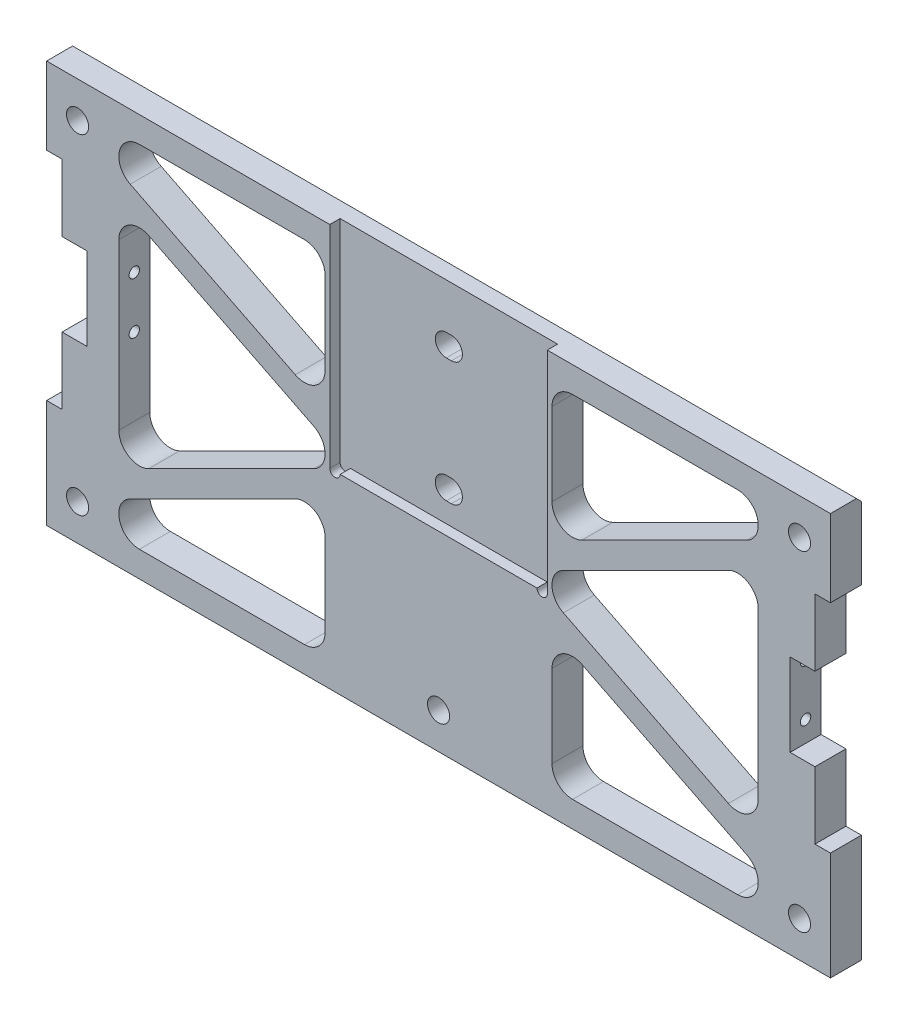
from build123d import *

# Parameters (mm, degrees)
SKETCH1_W                 = 120.65
SKETCH1_H                 = 61.9125
BOSS_EXTRUDE1_DEPTH       = 4.7625
SKETCH2_W                 = 4.7625
SKETCH2_H                 = 12.7254
BOSS_EXTRUDE2_DEPTH       = 22.225
CUT_EXTRUDE1_REACH        = 129.448
SKETCH3_R                 = 2.25
FILLET1_R                 = 6.35
FILLET1_OF_MIRROR2_R      = 6.35
M3_CLEARANCE_SLOT1_DEPTH  = 4.7625
SKETCH7_W                 = 2.38125
SKETCH7_H                 = 10.31875
CUT_EXTRUDE3_DEPTH        = 72.353666087
CUT_EXTRUDE4_DEPTH        = 6.207125
CUT_EXTRUDE5_DEPTH        = 72.353666087
CUT_EXTRUDE6_DEPTH        = 72.353666087
M2X0_4_TAPPED_HOLE1_D     = 1.6
M2X0_4_TAPPED_HOLE1_DEPTH = 4.905375
CUT_EXTRUDE7_DEPTH        = 1.5875
M3_CLEARANCE_HOLE2_D      = 3.4
CHAMFER1_SIZE             = 0.762


# Read off the part's stored shape, not the designer's step: M3 Clearance Slot1
with BuildPart() as part:
    # Sketch1 → Boss-Extrude1 (new body)
    with BuildSketch(Plane.XY):
        Rectangle(SKETCH1_W, SKETCH1_H)
    extrude(amount=BOSS_EXTRUDE1_DEPTH)

    # Sketch2 → Boss-Extrude2 (add)
    with BuildSketch(Plane.XY.offset(4.7625)):
        with Locations((-57.94375, 2.38125)):
            Rectangle(SKETCH2_W, SKETCH2_H)
    boss_extrude2 = extrude(amount=BOSS_EXTRUDE2_DEPTH)

    # Sketch3 → Cut-Extrude1 (cut, up to next)
    with BuildSketch(Plane.ZY.offset(60.325), mode=Mode.PRIVATE) as cut_extrude1_sk1:
        with Locations((19.05, 2.36855)):
            Circle(SKETCH3_R)
    cut_extrude1_tool1 = extrude(cut_extrude1_sk1.sketch, amount=-CUT_EXTRUDE1_REACH, mode=Mode.PRIVATE) & part.part
    cut_extrude1 = cut_extrude1_tool1.solids().sort_by_distance((-60.325, 2.36855, 19.05))[0]
    add(cut_extrude1, mode=Mode.SUBTRACT)

    # Fillet1
    fillet1_edges = [part.edges().sort_by_distance(p)[0] for p in [
        (-57.94375, -3.98145, 26.9875),
        (-57.94375, 8.74395, 26.9875),
    ]]
    fillet(fillet1_edges, radius=FILLET1_R)

    # Mirror2: Boss-Extrude2, Cut-Extrude1 across plane
    add(boss_extrude2.mirror(Plane(origin=(0, 0, 0), x_dir=(0, 0, 1), z_dir=(1, 0, 0))))
    add(cut_extrude1.mirror(Plane(origin=(0, 0, 0), x_dir=(0, 0, 1), z_dir=(1, 0, 0))), mode=Mode.SUBTRACT)

    # Fillet1 of Mirror2
    fillet1_of_mirror2_edges = [part.edges().sort_by_distance(p)[0] for p in [
        (57.94375, -3.98145, 26.9875),
        (57.94375, 8.74395, 26.9875),
    ]]
    fillet(fillet1_of_mirror2_edges, radius=FILLET1_OF_MIRROR2_R)

    # M3 Clearance Slot1 outline → M3 Clearance Slot1 (cut)
    with BuildSketch(Plane.XY):
        with BuildLine():
            ThreePointArc((0.386099968, 1.50675), (2.086099968, 3.20675), (0.386099968, 4.90675))
            Line((0.386099968, 4.90675), (-0.386099968, 4.90675))
            ThreePointArc((-0.386099968, 4.90675), (-2.086099968, 3.20675), (-0.386099968, 1.50675))
            Line((-0.386099968, 1.50675), (0.386099968, 1.50675))
        make_face()
        with BuildLine():
            ThreePointArc((0.386099968, 20.55675), (2.086099968, 22.25675), (0.386099968, 23.95675))
            Line((0.386099968, 23.95675), (-0.386099968, 23.95675))
            ThreePointArc((-0.386099968, 23.95675), (-2.086099968, 22.25675), (-0.386099968, 20.55675))
            Line((-0.386099968, 20.55675), (0.386099968, 20.55675))
        make_face()
    extrude(amount=M3_CLEARANCE_SLOT1_DEPTH, mode=Mode.SUBTRACT)

    # Sketch7 → Cut-Extrude3 (cut, through all)
    with BuildSketch(Plane.XY.offset(4.7625)):
        with Locations((-59.134375, 13.903325)):
            Rectangle(SKETCH7_W, SKETCH7_H)
        with Locations((-59.134375, -9.140825)):
            Rectangle(SKETCH7_W, SKETCH7_H)
    cut_extrude3 = extrude(amount=-CUT_EXTRUDE3_DEPTH, mode=Mode.SUBTRACT)

    # Sketch8 → Cut-Extrude4 (cut)
    with BuildSketch(Plane.ZY.offset(60.325)):
        with BuildLine():
            Line((0, 8.74395), (0, -3.98145))
            Line((0, -3.98145), (20.6375, -3.98145))
            ThreePointArc((20.6375, -3.98145), (25.127628061, -2.121578061), (26.9875, 2.36855))
            Line((26.9875, 2.36855), (26.9875, 2.39395))
            ThreePointArc((26.9875, 2.39395), (25.127628061, 6.884078061), (20.6375, 8.74395))
            Line((20.6375, 8.74395), (0, 8.74395))
        make_face()
    cut_extrude4 = extrude(amount=-CUT_EXTRUDE4_DEPTH, mode=Mode.SUBTRACT)

    # Sketch11 → Cut-Extrude5 (cut, through all)
    with BuildSketch(Plane.XY.offset(4.7625)):
        with BuildLine():
            Line((-19.217596834, 2.839806331), (-44.617596834, 15.539806331))
            ThreePointArc((-44.617596834, 15.539806331), (-47.706696281, 15.400816317), (-49.2125, 12.7))
            Line((-49.2125, 12.7), (-49.2125, -12.7))
            ThreePointArc((-49.2125, -12.7), (-47.706696281, -15.400816317), (-44.617596834, -15.539806331))
            Line((-44.617596834, -15.539806331), (-19.217596834, -2.839806331))
            ThreePointArc((-19.217596834, -2.839806331), (-17.4625, 0), (-19.217596834, 2.839806331))
        make_face()
    cut_extrude5 = extrude(amount=-CUT_EXTRUDE5_DEPTH, mode=Mode.SUBTRACT)

    # Sketch12 → Cut-Extrude6 (cut, through all)
    with BuildSketch(Plane.XY.offset(4.7625)):
        with BuildLine():
            Line((-47.457403166, 20.972693669), (-22.057403166, 8.272693669))
            ThreePointArc((-22.057403166, 8.272693669), (-18.968303719, 8.411683683), (-17.4625, 11.1125))
            Line((-17.4625, 11.1125), (-17.4625, 23.8125))
            ThreePointArc((-17.4625, 23.8125), (-18.39243597, 26.05756403), (-20.6375, 26.9875))
            Line((-20.6375, 26.9875), (-46.0375, 26.9875))
            ThreePointArc((-46.0375, 26.9875), (-49.127565542, 24.541965523), (-47.457403166, 20.972693669))
        make_face()
        with BuildLine():
            Line((-20.6375, -26.9875), (-46.0375, -26.9875))
            ThreePointArc((-46.0375, -26.9875), (-49.127565542, -24.541965523), (-47.457403166, -20.972693669))
            Line((-47.457403166, -20.972693669), (-22.057403166, -8.272693669))
            ThreePointArc((-22.057403166, -8.272693669), (-18.968303719, -8.411683683), (-17.4625, -11.1125))
            Line((-17.4625, -11.1125), (-17.4625, -23.8125))
            ThreePointArc((-17.4625, -23.8125), (-18.39243597, -26.05756403), (-20.6375, -26.9875))
        make_face()
    cut_extrude6 = extrude(amount=-CUT_EXTRUDE6_DEPTH, mode=Mode.SUBTRACT)

    # M2x0.4 Tapped Hole1
    with Locations(Plane.ZY.offset(54.117875)):
        with Locations((2.38125, 7.14375), (2.38125, -0.79375)):
            m2x0_4_tapped_hole1 = Hole(M2X0_4_TAPPED_HOLE1_D / 2, depth=M2X0_4_TAPPED_HOLE1_DEPTH)

    # Mirror4: Cut-Extrude5, Cut-Extrude6 across plane
    add(cut_extrude5.mirror(Plane(origin=(0, 0, 0), x_dir=(0, 0, 1), z_dir=(1, 0, 0))), mode=Mode.SUBTRACT)
    add(cut_extrude6.mirror(Plane(origin=(0, 0, 0), x_dir=(0, 0, 1), z_dir=(1, 0, 0))), mode=Mode.SUBTRACT)

    # Mirror3: Cut-Extrude3, Cut-Extrude4, M2x0.4 Tapped Hole1 across plane
    add(cut_extrude3.mirror(Plane(origin=(0, 0, 0), x_dir=(0, 0, 1), z_dir=(1, 0, 0))), mode=Mode.SUBTRACT)
    add(cut_extrude4.mirror(Plane(origin=(0, 0, 0), x_dir=(0, 0, 1), z_dir=(1, 0, 0))), mode=Mode.SUBTRACT)
    add(m2x0_4_tapped_hole1.mirror(Plane(origin=(0, 0, 0), x_dir=(0, 0, 1), z_dir=(1, 0, 0))), mode=Mode.SUBTRACT)

    # Sketch13 → Cut-Extrude7 (cut)
    with BuildSketch(Plane.XY.offset(4.7625)):
        with BuildLine():
            Line((-16.7386, 30.95625), (-16.7386, -1.55575))
            ThreePointArc((-16.7386, -1.55575), (-15.94485, -2.3495), (-15.1511, -1.55575))
            Line((-15.1511, -1.55575), (15.1511, -1.55575))
            ThreePointArc((15.1511, -1.55575), (15.94485, -2.3495), (16.7386, -1.55575))
            Line((16.7386, -1.55575), (16.7386, 30.95625))
            Line((16.7386, 30.95625), (-16.7386, 30.95625))
        make_face()
    extrude(amount=-CUT_EXTRUDE7_DEPTH, mode=Mode.SUBTRACT)

    # M3 Clearance Hole2 (through all)
    with Locations(Plane.XY.offset(4.7625)):
        with Locations((-55.5625, 25.4), (-55.5625, -25.4), (0, -25.4), (55.5625, 25.4), (55.5625, -25.4)):
            Hole(M3_CLEARANCE_HOLE2_D / 2)

    # Chamfer1
    chamfer1_edges = [part.edges().sort_by_distance(p)[0] for p in [
        (0, 30.95625, 0),
    ]]
    chamfer(chamfer1_edges, length=CHAMFER1_SIZE)


solid = part.part
